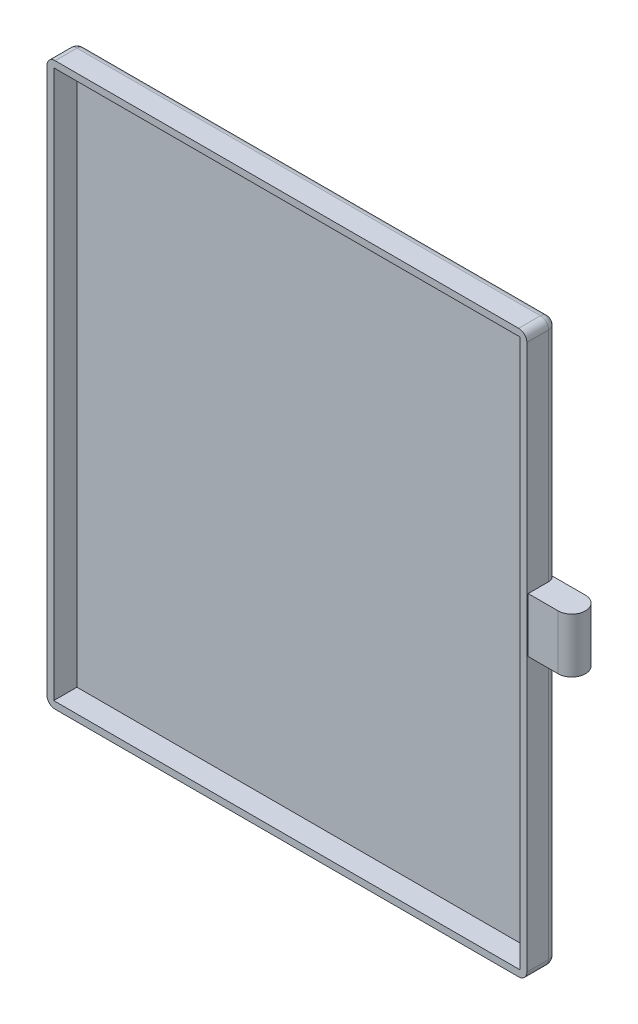
from build123d import *

# Parameters (mm, degrees)
SKETCH1_W           = 88
SKETCH1_H           = 103
BOSS_EXTRUDE1_DEPTH = 5.5
SHELL1_T            = -1.25
SKETCH2_W           = 5
SKETCH2_H           = 10
BOSS_EXTRUDE2_DEPTH = 8
FILLET1_RADIUS      = 2.5
FILLET1_LENGTH      = 10
SKETCH3_R           = 1.5
CUT_EXTRUDE1_DEPTH  = 3
FILLET2_R           = 1.5


with BuildPart() as part:
    # Sketch1 → Boss-Extrude1 (new body)
    with BuildSketch(Plane.XY):
        Rectangle(SKETCH1_W, SKETCH1_H)
    extrude(amount=BOSS_EXTRUDE1_DEPTH)

    # Shell1
    shell1_openings = [part.faces().sort_by_distance(p)[0] for p in [
        (0, 0, 5.5),
    ]]
    offset(amount=SHELL1_T, openings=shell1_openings, kind=Kind.INTERSECTION)

    # Sketch2 → Boss-Extrude2 (add)
    with BuildSketch(Plane(origin=(44, 0, 0), x_dir=(0, 0, -1), z_dir=(1, 0, 0))):
        with Locations((-2.75, 5)):
            Rectangle(SKETCH2_W, SKETCH2_H)
    extrude(amount=BOSS_EXTRUDE2_DEPTH)

    # Fillet1: full round fillet: the end face becomes a half cylinder, R = half its width
    fillet1_face = Plane((52, 5, 2.75), x_dir=(0, 1, 0), z_dir=(1, 0, 0))  # on the end face: x along it, z out of the body
    fillet1_slab = fillet1_face.offset(-FILLET1_RADIUS / 2) * Box(FILLET1_LENGTH, 2 * FILLET1_RADIUS, FILLET1_RADIUS, mode=Mode.PRIVATE)  # the body's end, R deep
    fillet1_round = Plane((49.5, 5, 2.75), x_dir=(1, 0, 0), z_dir=(0, 1, 0)) * Cylinder(FILLET1_RADIUS, FILLET1_LENGTH, mode=Mode.PRIVATE)  # its axis R under the face
    add(fillet1_slab - fillet1_round, mode=Mode.SUBTRACT)

    # Sketch3 → Cut-Extrude1 (cut)
    with BuildSketch(Plane.XZ):
        with Locations((49.5, 2.75)):
            Circle(SKETCH3_R)
    extrude(amount=-CUT_EXTRUDE1_DEPTH, mode=Mode.SUBTRACT)

    # Fillet2
    # the kernel refuses this fillet: 1.5 mm, written as the material it takes off along each edge
    with BuildSketch(Plane(origin=(-42.5, -50, 1.5), x_dir=(0, 0, -1), z_dir=(-1, 0, 0))) as fillet2_piece_1_section:
        Polygon((0, 0), (FILLET2_R, 0), (FILLET2_R, FILLET2_R), (0, FILLET2_R), align=None)
    fillet2_piece_1 = extrude(amount=FILLET2_R, mode=Mode.PRIVATE)
    fillet2_piece_1 = fillet2_piece_1 - Plane(origin=(-42.5, -50, 1.5), x_dir=(0, 0.7071067811865475, 0.7071067811865475), z_dir=(-1, 0, 0)) * Sphere(FILLET2_R, mode=Mode.PRIVATE)
    add(fillet2_piece_1, mode=Mode.SUBTRACT)
    with BuildSketch(Plane(origin=(-42.5, 50, 1.5), x_dir=(-1, 0, 0), z_dir=(0, 1, 0))) as fillet2_piece_2_section:
        Polygon((0, 0), (FILLET2_R, 0), (FILLET2_R, -FILLET2_R), (0, -FILLET2_R), align=None)
    fillet2_piece_2 = extrude(amount=FILLET2_R, mode=Mode.PRIVATE)
    fillet2_piece_2 = fillet2_piece_2 - Plane(origin=(-42.5, 50, 1.5), x_dir=(0.7071067811865475, 0, 0.7071067811865475), z_dir=(0, 1, 0)) * Sphere(FILLET2_R, mode=Mode.PRIVATE)
    add(fillet2_piece_2, mode=Mode.SUBTRACT)
    with BuildSketch(Plane(origin=(42.5, -50, 1.5), x_dir=(0, 0, -1), z_dir=(1, 0, 0))) as fillet2_piece_3_section:
        Polygon((0, 0), (FILLET2_R, 0), (FILLET2_R, -FILLET2_R), (0, -FILLET2_R), align=None)
    fillet2_piece_3 = extrude(amount=FILLET2_R, mode=Mode.PRIVATE)
    fillet2_piece_3 = fillet2_piece_3 - Plane(origin=(42.5, -50, 1.5), x_dir=(0, 0.7071067811865475, 0.7071067811865475), z_dir=(1, 0, 0)) * Sphere(FILLET2_R, mode=Mode.PRIVATE)
    add(fillet2_piece_3, mode=Mode.SUBTRACT)
    with BuildSketch(Plane(origin=(42.5, 50, 1.5), x_dir=(1, 0, 0), z_dir=(0, 1, 0))) as fillet2_piece_4_section:
        Polygon((0, 0), (FILLET2_R, 0), (FILLET2_R, FILLET2_R), (0, FILLET2_R), align=None)
    fillet2_piece_4 = extrude(amount=FILLET2_R, mode=Mode.PRIVATE)
    fillet2_piece_4 = fillet2_piece_4 - Plane(origin=(42.5, 50, 1.5), x_dir=(-0.7071067811865475, 0, 0.7071067811865475), z_dir=(0, 1, 0)) * Sphere(FILLET2_R, mode=Mode.PRIVATE)
    add(fillet2_piece_4, mode=Mode.SUBTRACT)
    with BuildSketch(Plane(origin=(-44, -50, 0), x_dir=(0, 0, 1), z_dir=(0, 1, 0))) as fillet2_piece_5:
        with BuildLine():
            CenterArc((FILLET2_R, FILLET2_R), FILLET2_R, 180, 90)
            Line((0, FILLET2_R), (0, 0))
            Line((0, 0), (FILLET2_R, 0))
        make_face()
    extrude(amount=100, mode=Mode.SUBTRACT)
    with BuildSketch(Plane(origin=(42.5, -51.5, 0), x_dir=(0, 1, 0), z_dir=(-1, 0, 0))) as fillet2_piece_6:
        with BuildLine():
            CenterArc((FILLET2_R, -FILLET2_R), FILLET2_R, 90, 90)
            Line((0, -FILLET2_R), (0, 0))
            Line((0, 0), (FILLET2_R, 0))
        make_face()
    extrude(amount=85, mode=Mode.SUBTRACT)
    with BuildSketch(Plane(origin=(44, 50, 0), x_dir=(0, 0, 1), z_dir=(0, -1, 0))) as fillet2_piece_7_section:
        with BuildLine():
            CenterArc((FILLET2_R, FILLET2_R), FILLET2_R, 180, 90)
            Line((0, FILLET2_R), (0, 0))
            Line((0, 0), (FILLET2_R, 0))
        make_face()
    fillet2_piece_7 = extrude(amount=100, mode=Mode.PRIVATE)
    fillet2_piece_7 = split(fillet2_piece_7, bisect_by=Plane(origin=(43.836700162, 30, 0.25), z_dir=(0, 0, 1)), keep=Keep.TOP, mode=Mode.PRIVATE)
    fillet2_piece_7 = split(fillet2_piece_7, bisect_by=Plane(origin=(43.836700162, 10, 0.589852414), z_dir=(0, 1, 0)), keep=Keep.TOP, mode=Mode.PRIVATE)
    add(fillet2_piece_7, mode=Mode.SUBTRACT)
    with BuildSketch(Plane(origin=(44, 50, 0), x_dir=(0, 0, 1), z_dir=(0, -1, 0))) as fillet2_piece_8_section:
        with BuildLine():
            CenterArc((FILLET2_R, FILLET2_R), FILLET2_R, 180, 90)
            Line((0, FILLET2_R), (0, 0))
            Line((0, 0), (FILLET2_R, 0))
        make_face()
    fillet2_piece_8 = extrude(amount=100, mode=Mode.PRIVATE)
    fillet2_piece_8 = split(fillet2_piece_8, bisect_by=Plane(origin=(43.48515527, 30, 0.25), z_dir=(0, 0, -1)), keep=Keep.TOP, mode=Mode.PRIVATE)
    fillet2_piece_8 = split(fillet2_piece_8, bisect_by=Plane(origin=(43.48515527, 10, 0.09081038), z_dir=(0, 1, 0)), keep=Keep.TOP, mode=Mode.PRIVATE)
    add(fillet2_piece_8, mode=Mode.SUBTRACT)
    with BuildSketch(Plane(origin=(44, 50, 0), x_dir=(0, 0, 1), z_dir=(0, -1, 0))) as fillet2_piece_9_section:
        with BuildLine():
            CenterArc((FILLET2_R, FILLET2_R), FILLET2_R, 180, 90)
            Line((0, FILLET2_R), (0, 0))
            Line((0, 0), (FILLET2_R, 0))
        make_face()
    fillet2_piece_9 = extrude(amount=100, mode=Mode.PRIVATE)
    fillet2_piece_9 = split(fillet2_piece_9, bisect_by=Plane(origin=(43.48515527, 0, 0.09081038), z_dir=(0, 1, 0)), keep=Keep.TOP, mode=Mode.PRIVATE)
    fillet2_piece_9 = split(fillet2_piece_9, bisect_by=Plane(origin=(43.48515527, 5, 0.25), z_dir=(0, 0, -1)), keep=Keep.TOP, mode=Mode.PRIVATE)
    fillet2_piece_9 = split(fillet2_piece_9, bisect_by=Plane(origin=(43.48515527, 10, 0.09081038), z_dir=(0, -1, 0)), keep=Keep.TOP, mode=Mode.PRIVATE)
    add(fillet2_piece_9, mode=Mode.SUBTRACT)
    with BuildSketch(Plane(origin=(44, 50, 0), x_dir=(0, 0, 1), z_dir=(0, -1, 0))) as fillet2_piece_10_section:
        with BuildLine():
            CenterArc((FILLET2_R, FILLET2_R), FILLET2_R, 180, 90)
            Line((0, FILLET2_R), (0, 0))
            Line((0, 0), (FILLET2_R, 0))
        make_face()
    fillet2_piece_10 = extrude(amount=100, mode=Mode.PRIVATE)
    fillet2_piece_10 = split(fillet2_piece_10, bisect_by=Plane(origin=(43.836700162, 0, 0.589852414), z_dir=(0, -1, 0)), keep=Keep.TOP, mode=Mode.PRIVATE)
    fillet2_piece_10 = split(fillet2_piece_10, bisect_by=Plane(origin=(43.836700162, -25, 0.25), z_dir=(0, 0, 1)), keep=Keep.TOP, mode=Mode.PRIVATE)
    add(fillet2_piece_10, mode=Mode.SUBTRACT)
    with BuildSketch(Plane(origin=(44, 50, 0), x_dir=(0, 0, 1), z_dir=(0, -1, 0))) as fillet2_piece_11_section:
        with BuildLine():
            CenterArc((FILLET2_R, FILLET2_R), FILLET2_R, 180, 90)
            Line((0, FILLET2_R), (0, 0))
            Line((0, 0), (FILLET2_R, 0))
        make_face()
    fillet2_piece_11 = extrude(amount=100, mode=Mode.PRIVATE)
    fillet2_piece_11 = split(fillet2_piece_11, bisect_by=Plane(origin=(43.48515527, 0, 0.09081038), z_dir=(0, -1, 0)), keep=Keep.TOP, mode=Mode.PRIVATE)
    fillet2_piece_11 = split(fillet2_piece_11, bisect_by=Plane(origin=(43.48515527, -25, 0.25), z_dir=(0, 0, -1)), keep=Keep.TOP, mode=Mode.PRIVATE)
    add(fillet2_piece_11, mode=Mode.SUBTRACT)
    with BuildSketch(Plane(origin=(-42.5, 51.5, 0), x_dir=(0, 0, 1), z_dir=(1, 0, 0))) as fillet2_piece_12:
        with BuildLine():
            CenterArc((FILLET2_R, FILLET2_R), FILLET2_R, 180, 90)
            Line((0, FILLET2_R), (0, 0))
            Line((0, 0), (FILLET2_R, 0))
        make_face()
    extrude(amount=85, mode=Mode.SUBTRACT)
    with BuildSketch(Plane(origin=(44, 51.5, 1.5), x_dir=(-1, 0, 0), z_dir=(0, 0, 1)), Plane(origin=(44, -51.5, 1.5), x_dir=(0, 1, 0), z_dir=(0, 0, 1))) as fillet2_piece_13:
        with BuildLine():
            CenterArc((FILLET2_R, FILLET2_R), FILLET2_R, 180, 90)
            Line((0, FILLET2_R), (0, 0))
            Line((0, 0), (FILLET2_R, 0))
        make_face()
    extrude(amount=7.75, mode=Mode.SUBTRACT)
    with BuildSketch(Plane(origin=(-44, -51.5, 1.5), x_dir=(0, 1, 0), z_dir=(0, 0, 1)), Plane(origin=(-44, 51.5, 1.5), x_dir=(1, 0, 0), z_dir=(0, 0, 1))) as fillet2_piece_14:
        with BuildLine():
            CenterArc((FILLET2_R, -FILLET2_R), FILLET2_R, 90, 90)
            Line((0, -FILLET2_R), (0, 0))
            Line((0, 0), (FILLET2_R, 0))
        make_face()
    extrude(amount=7.75, mode=Mode.SUBTRACT)


solid = part.part
